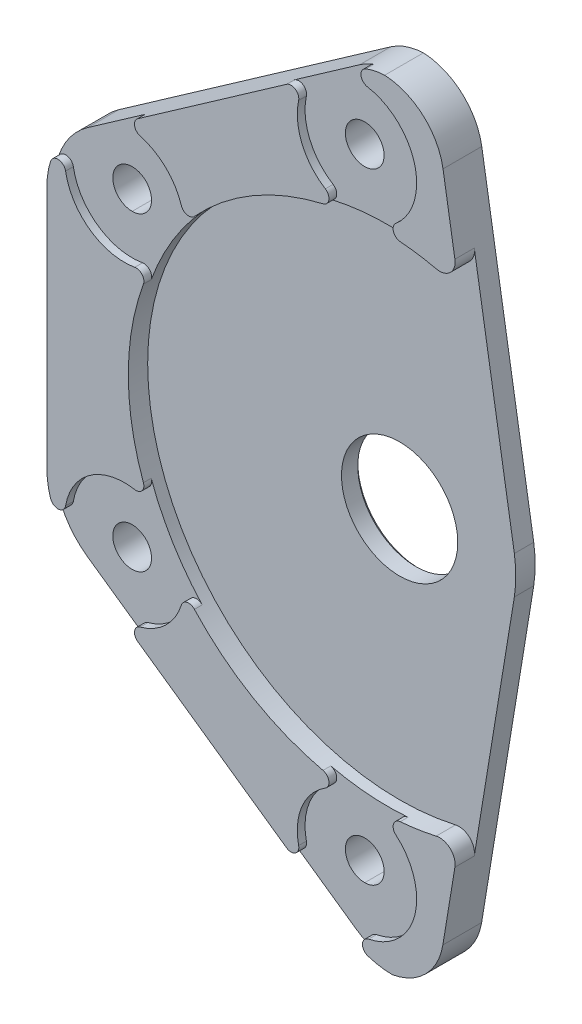
from build123d import *

# Parameters (mm, degrees)
SKETCH1_R           = 3.174999999999998
SKETCH1_R_2         = 3.1750000000000105
SKETCH1_R_3         = 3.17500000000001
SKETCH1_R_4         = 9.525
BOSS_EXTRUDE1_DEPTH = 6.35
SKETCH12_R          = 41.275000000000006
CUT_EXTRUDE3_DEPTH  = 3.175
FILLET3_R           = 12.7
FILLET5_R           = 10.16
FILLET6_R           = 12.7
CHAMFER1_SIZE       = 0.508
SKETCH16_R          = 9.779
SKETCH16_R_2        = 9.778999999999995
CUT_EXTRUDE6_DEPTH  = 1.27
FILLET7_R           = 1.27
FILLET8_R           = 2.54


with BuildPart() as part:
    # Sketch1 → Boss-Extrude1 (new body)
    with BuildSketch(Plane.XY):
        with BuildLine():
            Line((8.889999999999999, -63.5), (18.798846105166316, -3.0831615452767167))
            ThreePointArc((18.79884610516632, -3.0831615452767163), (19.049999999999997, -4.4e-16), (18.798846105166323, 3.083161545276716))
            Line((18.798846105166316, 3.083161545276716), (8.889999999999999, 63.5))
            Line((8.889999999999999, 63.5), (-2.0113089116884844, 63.5))
            Line((-2.011308911688488, 63.5), (-54.610000000000014, 26.669999999999998))
            Line((-54.61000000000001, 26.67), (-54.61000000000001, -26.67))
            Line((-54.610000000000014, -26.669999999999998), (-2.011308911688488, -63.5))
            Line((-2.011308911688488, -63.5), (8.89, -63.5))
        make_face()
        with Locations((-41.910000000000004, -25.4)):
            Circle(SKETCH1_R, mode=Mode.SUBTRACT)
        with Locations((-3.8099999999999934, -50.8)):
            Circle(SKETCH1_R_2, mode=Mode.SUBTRACT)
        with Locations((-41.910000000000004, 25.4)):
            Circle(SKETCH1_R, mode=Mode.SUBTRACT)
        with Locations((-3.8100000000000063, 50.8)):
            Circle(SKETCH1_R_3, mode=Mode.SUBTRACT)
        Circle(SKETCH1_R_4, mode=Mode.SUBTRACT)
    extrude(amount=BOSS_EXTRUDE1_DEPTH)

    # Sketch12 → Cut-Extrude3 (cut)
    with BuildSketch(Plane.XY.offset(6.35)):
        Circle(SKETCH12_R)
    extrude(amount=-CUT_EXTRUDE3_DEPTH, mode=Mode.SUBTRACT)

    # Fillet3
    fillet3_edges = [part.edges().sort_by_distance(p)[0] for p in [
        (-2.011308911688488, -63.5, 3.175),
        (-54.610000000000014, -26.67, 3.175),
    ]]
    fillet(fillet3_edges, radius=FILLET3_R)

    # Fillet5
    # the kernel refuses this fillet: 10.16 mm, written as the material it takes off along each edge
    with BuildSketch(Plane(origin=(8.889999999999999, 63.5, -21.57354203982315), x_dir=(-1, 0, 0), z_dir=(0, 0, 1))) as fillet5_piece_1:
        with BuildLine():
            CenterArc((FILLET5_R * 0.849352048812, FILLET5_R), FILLET5_R, 189.31404643684508, 80.68595356315495)
            Line((-FILLET5_R * 0.137464019701, FILLET5_R * 0.838154249592), (0, 0))
            Line((0, 0), (FILLET5_R * 0.849352048812, 0))
        make_face()
    extrude(amount=49.4970840796463, mode=Mode.SUBTRACT)
    with BuildSketch(Plane(origin=(-2.011308911688486, 63.5, -8.008589237526252), x_dir=(-0.8191520442889891, -0.5735764363510498, 0), z_dir=(0, 0, 1))) as fillet5_piece_2:
        with BuildLine():
            CenterArc((FILLET5_R * 0.315298788879, FILLET5_R), FILLET5_R, 234.99999999999972, 35.000000000000284)
            Line((-FILLET5_R * 0.258277647472, FILLET5_R * 0.180847955711), (0, 0))
            Line((0, 0), (FILLET5_R * 0.315298788879, 2e-17))
        make_face()
    extrude(amount=22.36717847505251, mode=Mode.SUBTRACT)
    with BuildSketch(Plane(origin=(8.89, -63.5, -21.185509481386156), x_dir=(-1, -1.03e-15, 0), z_dir=(0, 0, 1))) as fillet5_piece_3:
        with BuildLine():
            CenterArc((8.654537384170473, -10.006833294491324), FILLET5_R, 99.961393021195, 70.72456054195987)
            Line((-1.3715138719182247, -8.362480470343732), (0, 0))
            Line((0, 0), (6.897014292925349, 0))
        make_face()
    extrude(amount=48.721018962772305, mode=Mode.SUBTRACT)

    # Fillet6
    fillet6_edges = [part.edges().sort_by_distance(p)[0] for p in [
        (-54.610000000000014, 26.67, 3.175),
    ]]
    fillet(fillet6_edges, radius=FILLET6_R)

    # Chamfer1
    chamfer1_edges = [part.edges().sort_by_distance(p)[0] for p in [
        (-9.525, 1.17e-15, 0),
    ]]
    chamfer(chamfer1_edges, length=CHAMFER1_SIZE)

    # Sketch16 → Cut-Extrude6 (cut)
    with BuildSketch(Plane.XY.offset(6.35)):
        with Locations((-3.8100000000000063, 50.8)):
            Circle(SKETCH16_R)
        with Locations((-41.910000000000004, 25.4)):
            Circle(SKETCH16_R_2)
        with Locations((-41.910000000000004, -25.4)):
            Circle(SKETCH16_R_2)
        with Locations((-3.8099999999999934, -50.8)):
            Circle(SKETCH16_R)
    extrude(amount=-CUT_EXTRUDE6_DEPTH, mode=Mode.SUBTRACT)

    # Fillet7
    # the kernel refuses this fillet: 1.27 mm, written as the material it takes off along each edge
    with BuildSketch(Plane(origin=(-51.05033996469843, 28.876064776401133, 5.08), x_dir=(-0.09657343245290265, -0.9953258622904685, 0), z_dir=(0, 0, 1))) as fillet7_piece_1:
        with BuildLine():
            CenterArc((5.488895056500577, -1.2251054888152173), FILLET7_R, 105.27988641723195, 152.57651314637792)
            ThreePointArc((5.2217345964190285, -2.46668725759608), (2.468798122573326, -1.5340901167119672), (0, 0))
            ThreePointArc((0, 0), (2.5771031667716113, -0.34568773612281406), (5.154206333543225, 2e-17))
        make_face()
    extrude(amount=15.707593770740127, mode=Mode.SUBTRACT)
    with BuildSketch(Plane(origin=(-51.05033996469843, -28.876064776401122, 5.08), x_dir=(-0.09657343245290317, 0.9953258622904685, 0), z_dir=(0, 0, 1))) as fillet7_piece_2:
        with BuildLine():
            CenterArc((5.488895056500547, 1.2251054888152175), FILLET7_R, 102.14360043639026, 152.57651314637792)
            ThreePointArc((5.221734596418995, 2.4666872575960808), (2.468798122573309, 1.5340901167119605), (0, 0))
            ThreePointArc((0, 0), (2.577103166771601, 0.3456877361228138), (5.154206333543198, 2e-17))
        make_face()
    extrude(amount=15.707593770740052, mode=Mode.SUBTRACT)
    with BuildSketch(Plane(origin=(-4.405896500363429, -41.03917276247275, 5.08), x_dir=(-0.9859045184277648, 0.16730893742928732, 0), z_dir=(0, 0, 1))) as fillet7_piece_3:
        with BuildLine():
            CenterArc((5.122467383032978, 1.267626206798734), FILLET7_R, 131.65076211968278, 134.84555428453902)
            ThreePointArc((4.278440018803308, 2.2165823746123587), (2.277882855344697, 0.8406446175243522), (0, 0))
            ThreePointArc((0, 0), (2.522427120432931, 0.07714827904124132), (5.044854240865812, -6e-17))
        make_face()
    extrude(amount=13.88213560216453, mode=Mode.SUBTRACT)
    with BuildSketch(Plane(origin=(-1.764835382793802, -41.237252346290475, 5.08), x_dir=(0.9998310962098215, 0.01837876633146887, 0), z_dir=(0, 0, 1))) as fillet7_piece_4:
        with BuildLine():
            CenterArc((5.1224673830329825, -1.267626206798732), FILLET7_R, 93.5036835957782, 134.84555428453882)
            ThreePointArc((4.27844001880331, -2.216582374612353), (2.2778828553446977, -0.8406446175243475), (0, 0))
            ThreePointArc((0, 0), (2.522427120432899, -0.07714827904124524), (5.044854240865816, 0))
        make_face()
    extrude(amount=13.88213560216454, mode=Mode.SUBTRACT)
    with BuildSketch(Plane(origin=(-1.7648353827938124, 41.237252346290475, 5.08), x_dir=(0.9998310962098215, -0.018378766331468933, 0), z_dir=(0, 0, 1))) as fillet7_piece_5:
        with BuildLine():
            CenterArc((5.122467383032965, 1.267626206798732), FILLET7_R, 131.65076211968247, 134.84555428453936)
            ThreePointArc((4.278440018803301, 2.21658237461236), (2.277882855344692, 0.8406446175243475), (0, 0))
            ThreePointArc((0, 0), (2.5224271204329014, 0.07714827904124544), (5.044854240865799, 0))
        make_face()
    extrude(amount=13.882135602164494, mode=Mode.SUBTRACT)
    with BuildSketch(Plane(origin=(-4.40589650036344, 41.03917276247275, 5.08), x_dir=(-0.9859045184277646, -0.1673089374292877, 0), z_dir=(0, 0, 1))) as fillet7_piece_6:
        with BuildLine():
            CenterArc((5.122467383032965, -1.2676262067987338), FILLET7_R, 93.50368359577817, 134.84555428453905)
            ThreePointArc((4.278440018803295, -2.2165823746123583), (2.2778828553446893, -0.8406446175243446), (0, 0))
            ThreePointArc((0, 0), (2.5224271204328996, -0.07714827904124434), (5.044854240865799, -2e-17))
        make_face()
    extrude(amount=13.882135602164501, mode=Mode.SUBTRACT)
    with BuildSketch(Plane(origin=(-11.473504174062986, 56.87449954927312, 5.08), x_dir=(-0.42704799488174705, -0.9042289588746201, 0), z_dir=(0, 0, 1))) as fillet7_piece_7:
        with BuildLine():
            CenterArc((4.728427365439227, -1.2368396432560318), FILLET7_R, 103.12184472435666, 137.15851910421196)
            Line((4.098816822386599, -2.3397859538609374), (0, 0))
            ThreePointArc((0, 0), (2.2200543118220843, -0.25533474692856073), (4.440108623644155, 3e-17))
        make_face()
    extrude(amount=13.069072435302997, mode=Mode.SUBTRACT)
    with BuildSketch(Plane(origin=(-6.897089605429491, 60.07893952820306, 5.08), x_dir=(0.997331674160986, 0.07300364179439761, 0), z_dir=(0, 0, 1))) as fillet7_piece_8:
        with BuildLine():
            CenterArc((5.114789119152491, 1.2311102698497796), FILLET7_R, 106.07013934022241, 149.71417700442854)
            Line((4.763235479566721, 2.4514831794532332), (4.728080115608144, 2.5735204704135772))
            ThreePointArc((4.728080115608144, 2.5735204704135772), (2.3062016688784, 1.523381308565702), (-0.0650550978688258, 0.1090726099498725))
            Line((-0.0650550978688258, 0.1090726099498725), (0.03118773853141711, -0.12311102698497907))
            ThreePointArc((0.03118773853141711, -0.12311102698497907), (2.401455866919156, 0.17245092215670987), (4.771723995306896, -0.12311102698497724))
            Line((4.771723995306896, -0.12311102698497724), (4.802911733838314, 2e-17))
        make_face()
    extrude(amount=14.662671039822802, mode=Mode.SUBTRACT)
    with BuildSketch(Plane(origin=(-42.48178221863479, 35.16226951556107, 5.08), x_dir=(0.9945508568129161, -0.1042525453535521, 0), z_dir=(0, 0, 1))) as fillet7_piece_9:
        with BuildLine():
            CenterArc((3.378842887065313, 1.2531771116180899), FILLET7_R, 130.98410421956518, 129.67977154849987)
            Line((2.5459138672912713, 2.211889397978423), (0, 0))
            ThreePointArc((0, 0), (1.5864079408782286, 0.12953624054069557), (3.172815881756456, -1e-17))
        make_face()
    extrude(amount=9.701389316326873, mode=Mode.SUBTRACT)
    with BuildSketch(Plane(origin=(-37.82742730230863, 16.513974951190757, 5.08), x_dir=(-0.3708645160377428, -0.9286869821118904, 0), z_dir=(0, 0, 1))) as fillet7_piece_10:
        with BuildLine():
            CenterArc((2.6551557133591124, -1.2693626655560193), FILLET7_R, 91.81525494531378, 119.95574465095598)
            ThreePointArc((1.5754533971303504, -1.938050117457313), (0.8498547884410469, -0.9185207351456427), (0, 0))
            ThreePointArc((0, 0), (1.3074630406692571, -0.02071336942930664), (2.6149260813385156, -8e-17))
        make_face()
    extrude(amount=7.80731520334629, mode=Mode.SUBTRACT)
    with BuildSketch(Plane(origin=(-32.14341460501172, 25.89259590173067, 5.08), x_dir=(0.6516730455592312, 0.7584999945231087, 0), z_dir=(0, 0, 1))) as fillet7_piece_11:
        with BuildLine():
            CenterArc((2.6551557133590844, 1.269362665556021), FILLET7_R, 148.22900040373005, 119.9557446509564)
            ThreePointArc((1.5754533971303242, 1.9380501174573181), (0.8498547884410366, 0.9185207351456415), (0, 0))
            ThreePointArc((0, 0), (1.3074630406692533, 0.02071336942930512), (2.6149260813384925, 6e-17))
        make_face()
    extrude(amount=7.807315203346233, mode=Mode.SUBTRACT)
    with BuildSketch(Plane(origin=(-42.48178221863479, -35.16226951556107, 5.08), x_dir=(0.9945508568129161, 0.1042525453535521, 0), z_dir=(0, 0, 1))) as fillet7_piece_12:
        with BuildLine():
            CenterArc((3.378842887065313, -1.2531771116180899), FILLET7_R, 99.33612423193495, 129.67977154849942)
            Line((2.545913867291265, -2.211889397978415), (0, 0))
            ThreePointArc((0, 0), (1.5864079408782357, -0.12953624054069632), (3.172815881756456, 1e-17))
        make_face()
    extrude(amount=9.701389316326848, mode=Mode.SUBTRACT)
    with BuildSketch(Plane(origin=(-32.14341460501172, -25.89259590173067, 5.08), x_dir=(0.6516730455592307, -0.7584999945231092, 0), z_dir=(0, 0, 1))) as fillet7_piece_13:
        with BuildLine():
            CenterArc((2.6551557133590933, -1.2693626655560208), FILLET7_R, 91.81525494531361, 119.9557446509562)
            ThreePointArc((1.575453397130333, -1.938050117457314), (0.84985478844104, -0.9185207351456431), (0, 0))
            ThreePointArc((0, 0), (1.3074630406692458, -0.02071336942930215), (2.6149260813385, 1.9e-16))
        make_face()
    extrude(amount=7.807315203346251, mode=Mode.SUBTRACT)
    with BuildSketch(Plane(origin=(-37.82742730230863, -16.513974951190757, 5.08), x_dir=(-0.3708645160377417, 0.9286869821118909, 0), z_dir=(0, 0, 1))) as fillet7_piece_14:
        with BuildLine():
            CenterArc((2.6551557133591, 1.2693626655560195), FILLET7_R, 148.22900040372966, 119.95574465095666)
            ThreePointArc((1.5754533971303442, 1.9380501174573244), (0.8498547884410458, 0.9185207351456438), (0, 0))
            ThreePointArc((0, 0), (1.307463040669268, 0.02071336942931157), (2.614926081338505, -4e-17))
        make_face()
    extrude(amount=7.807315203346262, mode=Mode.SUBTRACT)
    with BuildSketch(Plane(origin=(-11.47350417406296, -56.87449954927313, 5.08), x_dir=(-0.4270479948817493, 0.904228958874619, 0), z_dir=(0, 0, 1))) as fillet7_piece_15:
        with BuildLine():
            CenterArc((4.728427365439235, 1.2368396432560307), FILLET7_R, 119.71963617143108, 137.15851910421213)
            Line((4.0988168223866115, 2.3397859538609413), (0, 0))
            ThreePointArc((0, 0), (2.220054311822089, 0.2553347469285633), (4.440108623644161, -6e-17))
        make_face()
    extrude(amount=13.069072435303026, mode=Mode.SUBTRACT)
    with BuildSketch(Plane(origin=(-6.897089605429501, -60.078939528203044, 5.08), x_dir=(0.9980757885501166, -0.06200580868001733, 0), z_dir=(0, 0, 1))) as fillet7_piece_16:
        with BuildLine():
            CenterArc((5.337031219122812, -1.2275977109055105), FILLET7_R, 104.84725695810936, 150.14086959564875)
            Line((5.00807682361887, -2.4542553671725873), (4.975181384068476, -2.5769211327992934))
            ThreePointArc((4.975181384068476, -2.5769211327992934), (1.6060241192382974, -1.1309170431421127), (-0.06625343227148527, -0.10834889345188184))
            Line((-0.06625343227148527, -0.10834889345188184), (0.0325428732873341, 0.1227597710905526))
            ThreePointArc((0.0325428732873341, 0.1227597710905526), (2.505801243124729, -0.19949762602756604), (4.979059612962133, 0.12275977109054963))
            Line((4.979059612962133, 0.12275977109054963), (5.011602486249467, 0))
        make_face()
    extrude(amount=15.212785517644045, mode=Mode.SUBTRACT)

    # Fillet8
    fillet8_edges = [part.edges().sort_by_distance(p)[0] for p in [
        (12.872720520102035, 39.21630644784571, 4.762499999999999),
        (12.872720520102039, -39.21630644784571, 4.762499999999999),
    ]]
    fillet(fillet8_edges, radius=FILLET8_R)


solid = part.part
